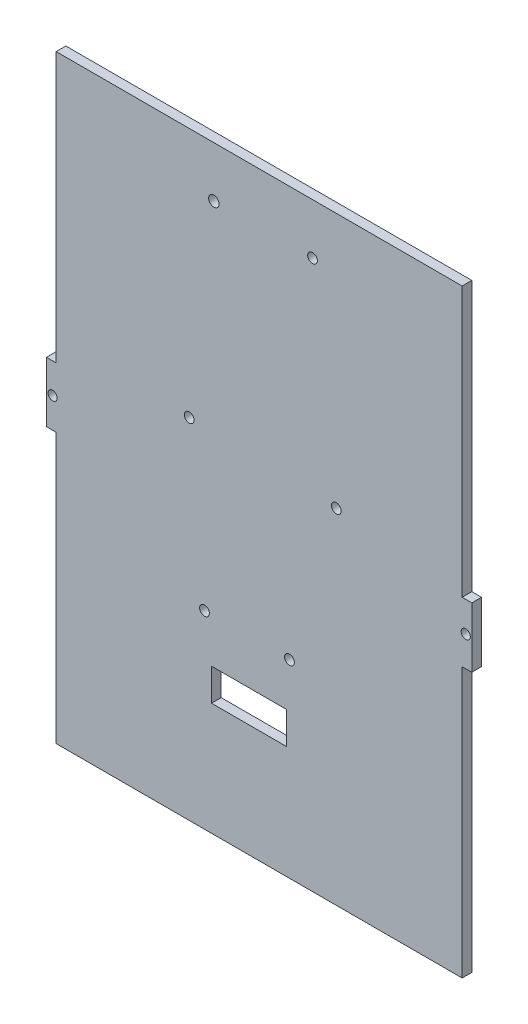
from build123d import *

# Parameters (mm, degrees)
SKETCH1_W           = 139.7
SKETCH1_H           = 203.2
BOSS_EXTRUDE1_DEPTH = 3.18
SKETCH2_R           = 1.5
SKETCH2_W           = 3.18
SKETCH2_H           = 91.725
CUT_EXTRUDE1_DEPTH  = 124.335700022
SKETCH3_R           = 1.59
CUT_EXTRUDE2_DEPTH  = 124.335700022
SKETCH4_R           = 1.59
CUT_EXTRUDE3_DEPTH  = 124.335700022
SKETCH5_W           = 88.895716174
SKETCH5_H           = 168.56277979
BOSS_EXTRUDE2_DEPTH = 3.18
SKETCH6_W           = 20
SKETCH6_H           = 203.2
BOSS_EXTRUDE3_DEPTH = 3.18
SKETCH7_W           = 56.795
SKETCH7_H           = 3.18
CUT_EXTRUDE4_DEPTH  = 124.335700022
SKETCH8_W           = 133.34
SKETCH8_H           = 3.18
CUT_EXTRUDE5_DEPTH  = 124.335700022
SKETCH9_R           = 1.6
CUT_EXTRUDE6_DEPTH  = 124.335700022
SKETCH10_W          = 24.565797096
SKETCH10_H          = 10.537213664
CUT_EXTRUDE7_DEPTH  = 3.18
SKETCH11_R          = 1.59
SKETCH11_R_2        = 1.71788268
CUT_EXTRUDE8_DEPTH  = 35
SKETCH12_W          = 3.18
SKETCH12_H          = 3.18
CUT_EXTRUDE9_DEPTH  = 130.184937299


with BuildPart() as part:
    # Sketch1 → Boss-Extrude1 (new body)
    with BuildSketch(Plane.XY):
        Rectangle(SKETCH1_W, SKETCH1_H)
    extrude(amount=BOSS_EXTRUDE1_DEPTH)

    # Sketch2 → Cut-Extrude1 (cut, through all)
    with BuildSketch(Plane.XY.offset(3.18)):
        with Locations((-67.85, 0)):
            Circle(SKETCH2_R)
        with Locations((67.85, 0)):
            Circle(SKETCH2_R)
        Polygon((-10, 101.6), (10, 101.6), (10, 98.42), (1.5, 98.42), (1.5, 94.42), (3.5, 94.42), (3.5, 91.42), (1.5, 91.42), (1.5, 88.42), (-1.5, 88.42), (-1.5, 91.42), (-3.5, 91.42), (-3.5, 94.42), (-1.5, 94.42), (-1.5, 98.42), (-10, 98.42), align=None)
        Polygon((-10, -101.6), (-10, -98.42), (-1.5, -98.42), (-1.5, -94.42), (-3.5, -94.42), (-3.5, -91.42), (-1.5, -91.42), (-1.5, -88.42), (1.5, -88.42), (1.5, -91.42), (3.5, -91.42), (3.5, -94.42), (1.5, -94.42), (1.5, -98.42), (10, -98.42), (10, -101.6), align=None)
        with Locations((-68.26, 55.7375)):
            Rectangle(SKETCH2_W, SKETCH2_H)
        with Locations((-68.26, -55.7375)):
            Rectangle(SKETCH2_W, SKETCH2_H)
        with Locations((68.26, -55.7375)):
            Rectangle(SKETCH2_W, SKETCH2_H)
        with Locations((68.26, 55.7375)):
            Rectangle(SKETCH2_W, SKETCH2_H)
    extrude(amount=-CUT_EXTRUDE1_DEPTH, mode=Mode.SUBTRACT)

    # Sketch3 → Cut-Extrude2 (cut, through all)
    with BuildSketch(Plane(origin=(0, 0, 0), x_dir=(-1, 0, 0), z_dir=(0, 0, -1))):
        with Locations((-35.67127699, -47.963396943)):
            Circle(SKETCH3_R)
        with Locations((-35.67127699, -30.777287406)):
            Circle(SKETCH3_R)
    extrude(amount=-CUT_EXTRUDE2_DEPTH, mode=Mode.SUBTRACT)

    # Sketch4 → Cut-Extrude3 (cut, through all)
    with BuildSketch(Plane(origin=(0, 0, 0), x_dir=(-1, 0, 0), z_dir=(0, 0, -1))):
        with Locations((-34.750723073, 80.736128989)):
            Circle(SKETCH4_R)
        with Locations((-34.750723073, 63.550019452)):
            Circle(SKETCH4_R)
        with Locations((36.249784221, 80.736128989)):
            Circle(SKETCH4_R)
        with Locations((36.249784221, 63.550019452)):
            Circle(SKETCH4_R)
        with Locations((35.983928162, -30.777287406)):
            Circle(SKETCH4_R)
        with Locations((35.983928162, -47.963396943)):
            Circle(SKETCH4_R)
        with Locations((-35.67127699, -30.777287406)):
            Circle(SKETCH4_R)
        with Locations((-35.67127699, -47.963396943)):
            Circle(SKETCH4_R)
    extrude(amount=-CUT_EXTRUDE3_DEPTH, mode=Mode.SUBTRACT)

    # Sketch5 → Boss-Extrude2 (add)
    with BuildSketch(Plane.XY.offset(3.18)):
        Rectangle(SKETCH5_W, SKETCH5_H)
    extrude(amount=-BOSS_EXTRUDE2_DEPTH)

    # Sketch6 → Boss-Extrude3 (add)
    with BuildSketch(Plane.XY.offset(3.18)):
        Rectangle(SKETCH6_W, SKETCH6_H)
    extrude(amount=-BOSS_EXTRUDE3_DEPTH)

    # Sketch7 → Cut-Extrude4 (cut, through all)
    with BuildSketch(Plane.XY.offset(3.18)):
        with Locations((-38.2725, -100.01)):
            Rectangle(SKETCH7_W, SKETCH7_H)
        with Locations((38.2725, -100.01)):
            Rectangle(SKETCH7_W, SKETCH7_H)
    extrude(amount=-CUT_EXTRUDE4_DEPTH, mode=Mode.SUBTRACT)

    # Sketch8 → Cut-Extrude5 (cut, through all)
    with BuildSketch(Plane.XY.offset(3.18)):
        with Locations((0, 100.01)):
            Rectangle(SKETCH8_W, SKETCH8_H)
    extrude(amount=-CUT_EXTRUDE5_DEPTH, mode=Mode.SUBTRACT)

    # Sketch9 → Cut-Extrude6 (cut, through all)
    with BuildSketch(Plane.XY.offset(3.18)):
        with Locations((-17.947926552, -36.205077673)):
            Circle(SKETCH9_R)
        with Locations((25.333125389, 14.525884697)):
            Circle(SKETCH9_R)
        with Locations((-22.964258499, 16.202998173)):
            Circle(SKETCH9_R)
        with Locations((9.952037888, -36.24962266)):
            Circle(SKETCH9_R)
    extrude(amount=-CUT_EXTRUDE6_DEPTH, mode=Mode.SUBTRACT)

    # Sketch10 → Cut-Extrude7 (cut)
    with BuildSketch(Plane.XY.offset(3.18)):
        with Locations((-3.359789788, -56.149532718)):
            Rectangle(SKETCH10_W, SKETCH10_H)
    extrude(amount=-CUT_EXTRUDE7_DEPTH, mode=Mode.SUBTRACT)

    # Sketch11 → Cut-Extrude8 (cut)
    with BuildSketch(Plane.XY.offset(3.18)):
        with Locations((17.523878239, 81.797398404)):
            Circle(SKETCH11_R)
        with Locations((-14.883091948, 81.797398404)):
            Circle(SKETCH11_R_2)
    extrude(amount=-CUT_EXTRUDE8_DEPTH, mode=Mode.SUBTRACT)

    # Sketch12 → Cut-Extrude9 (cut, through all)
    with BuildSketch(Plane.ZY.offset(9.875)):
        with Locations((1.59, -100.01)):
            Rectangle(SKETCH12_W, SKETCH12_H)
    extrude(amount=-CUT_EXTRUDE9_DEPTH, mode=Mode.SUBTRACT)


solid = part.part
